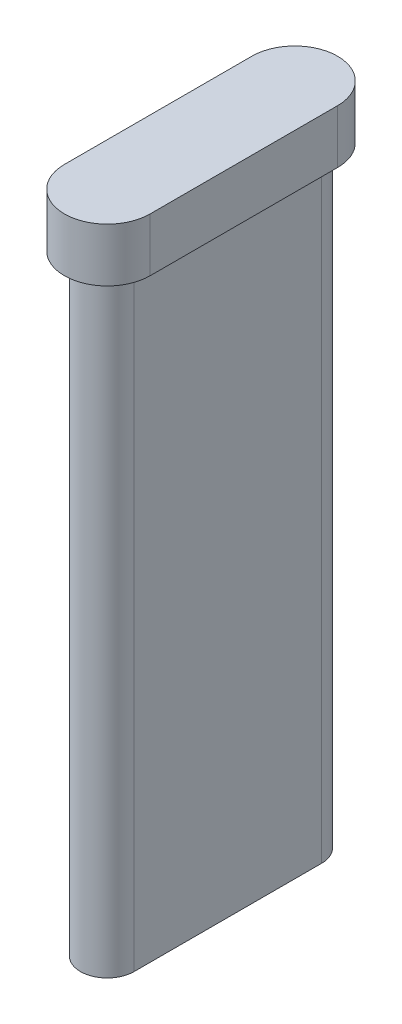
from build123d import *

# Parameters (mm, degrees)
BOSS_EXTRUDE1_DEPTH = 62
BOSS_EXTRUDE2_DEPTH = 5


with BuildPart() as part:
    # Sketch1 → Boss-Extrude1 (new body)
    with BuildSketch(Plane(origin=(0, 0, 0), x_dir=(1, 0, 0), z_dir=(0, 1, 0))):
        with BuildLine():
            Line((-2.5, -8.75), (-2.5, 8.75))
            ThreePointArc((-2.5, 8.75), (0, 11.25), (2.5, 8.75))
            Line((2.5, 8.75), (2.5, -8.75))
            ThreePointArc((2.5, -8.75), (0, -11.25), (-2.5, -8.75))
        make_face()
    extrude(amount=-BOSS_EXTRUDE1_DEPTH)

    # Sketch2 → Boss-Extrude2 (add)
    with BuildSketch(Plane(origin=(0, 0, 0), x_dir=(1, 0, 0), z_dir=(0, 1, 0))):
        with BuildLine():
            Line((4, -8.75), (4, 8.75))
            ThreePointArc((4, 8.75), (0, 12.75), (-4, 8.75))
            Line((-4, 8.75), (-4, -8.75))
            ThreePointArc((-4, -8.75), (0, -12.75), (4, -8.75))
        make_face()
    extrude(amount=-BOSS_EXTRUDE2_DEPTH)


solid = part.part
